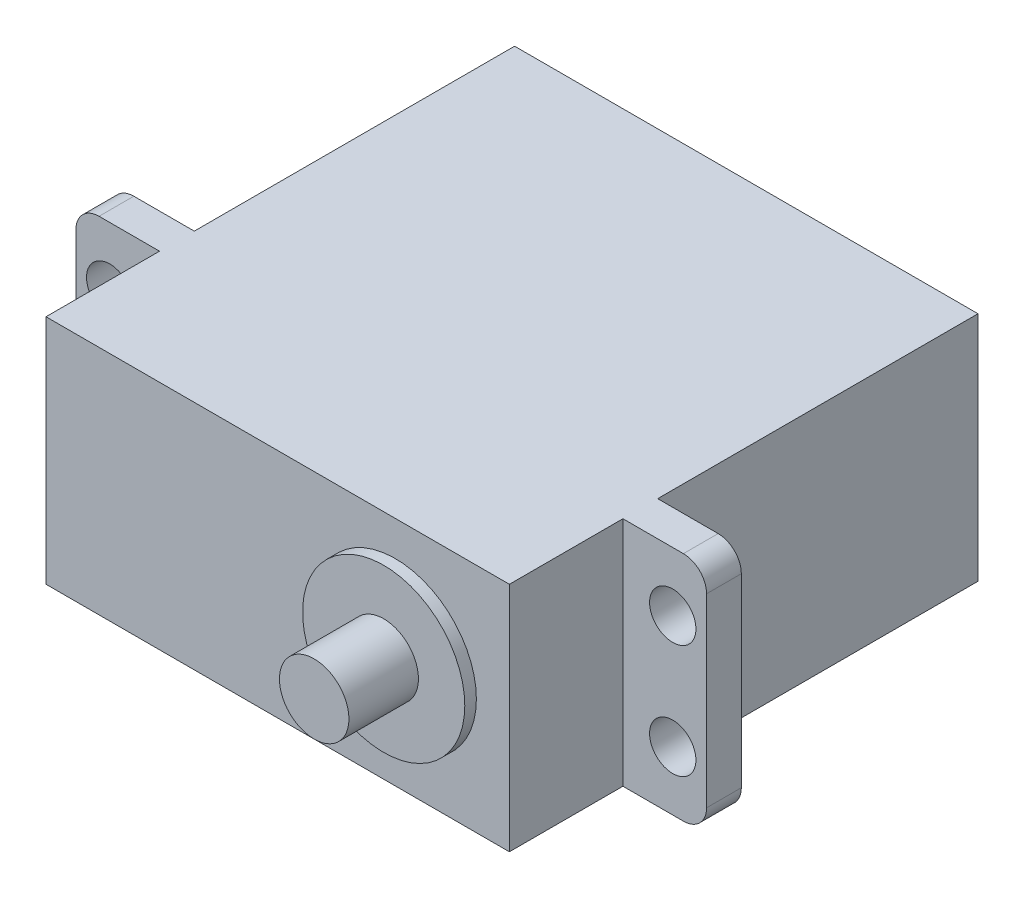
from build123d import *

# Parameters (mm, degrees)
SKETCH2_W           = 40
SKETCH2_H           = 20
BOSS_EXTRUDE1_DEPTH = 27.65
SKETCH3_W           = 54.44
SKETCH3_H           = 20
SKETCH3_R           = 2
BOSS_EXTRUDE2_DEPTH = 3
SKETCH4_W           = 40
SKETCH4_H           = 20
BOSS_EXTRUDE3_DEPTH = 9.8
SKETCH5_R           = 7
BOSS_EXTRUDE4_DEPTH = 1
SKETCH6_R           = 3
BOSS_EXTRUDE5_DEPTH = 6
FILLET1_R           = 2


with BuildPart() as part:
    # Sketch2 → Boss-Extrude1 (new body)
    with BuildSketch(Plane.XY):
        with Locations((-33.592215537, 218.387921433)):
            Rectangle(SKETCH2_W, SKETCH2_H)
    extrude(amount=BOSS_EXTRUDE1_DEPTH)

    # Sketch3 → Boss-Extrude2 (add)
    with BuildSketch(Plane.XY.offset(27.65)):
        with Locations((-33.592215537, 218.387921433)):
            Rectangle(SKETCH3_W, SKETCH3_H)
        with Locations((-9.292215537, 213.487921433)):
            Circle(SKETCH3_R, mode=Mode.SUBTRACT)
        with Locations((-9.292215537, 223.287921433)):
            Circle(SKETCH3_R, mode=Mode.SUBTRACT)
        with Locations((-57.892215537, 223.287921433)):
            Circle(SKETCH3_R, mode=Mode.SUBTRACT)
        with Locations((-57.892215537, 213.487921433)):
            Circle(SKETCH3_R, mode=Mode.SUBTRACT)
    extrude(amount=BOSS_EXTRUDE2_DEPTH)

    # Sketch4 → Boss-Extrude3 (add)
    with BuildSketch(Plane.XY.offset(30.65)):
        with Locations((-33.592215537, 218.387921433)):
            Rectangle(SKETCH4_W, SKETCH4_H)
    extrude(amount=BOSS_EXTRUDE3_DEPTH)

    # Sketch5 → Boss-Extrude4 (add)
    with BuildSketch(Plane.XY.offset(40.45)):
        with Locations((-23.442215537, 218.387921433)):
            Circle(SKETCH5_R)
    extrude(amount=BOSS_EXTRUDE4_DEPTH)

    # Sketch6 → Boss-Extrude5 (add)
    with BuildSketch(Plane.XY.offset(41.45)):
        with Locations((-23.442215537, 218.387921433)):
            Circle(SKETCH6_R)
    extrude(amount=BOSS_EXTRUDE5_DEPTH)

    # Fillet1
    fillet1_edges = [part.edges().sort_by_distance(p)[0] for p in [
        (-60.812215537, 228.387921433, 29.15),
        (-60.812215537, 208.387921433, 29.15),
        (-6.372215537, 228.387921433, 29.15),
        (-6.372215537, 208.387921433, 29.15),
    ]]
    fillet(fillet1_edges, radius=FILLET1_R)


solid = part.part
